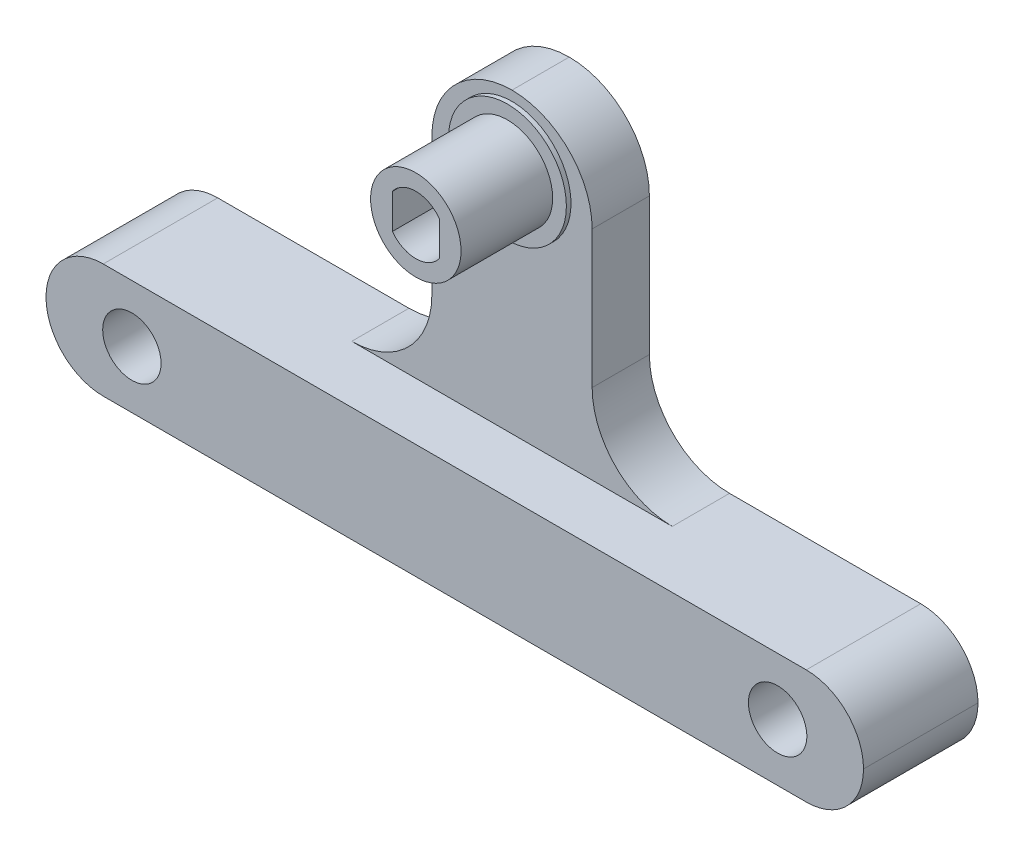
from build123d import *

# Parameters (mm, degrees)
SKETCH2_W           = 71.4
SKETCH2_H           = 93
SKETCH2_W_2         = 51.4
SKETCH2_H_2         = 73
BOSS_EXTRUDE1_DEPTH = 10
SKETCH3_W           = 14
SKETCH3_H           = 26
SKETCH3_R           = 2.75
BOSS_EXTRUDE2_DEPTH = 5
SKETCH4_R           = 3.95
SKETCH4_R_2         = 2.75
BOSS_EXTRUDE3_DEPTH = 8.4
SKETCH5_W           = 51.4
SKETCH5_H           = 10
CUT_EXTRUDE1_DEPTH  = 65.130647899
SKETCH6_R           = 5.15
SKETCH6_R_2         = 3.95
BOSS_EXTRUDE4_DEPTH = 0.4
SKETCH7_W           = 71.4
SKETCH7_H           = 25
CUT_EXTRUDE2_DEPTH  = 65.130647899
FILLET1_START       = -46.5
FILLET1_DEPTH       = 5
FILLET1_2_DEPTH     = 5
SKETCH10_W          = 71.4
SKETCH10_H          = 58
CUT_EXTRUDE3_DEPTH  = 65.130647899
SKETCH9_R           = 2.55
CUT_EXTRUDE4_DEPTH  = 53.440919138
FILLET2_R           = 5
SKETCH11_R          = 2.75
BOSS_EXTRUDE5_DEPTH = 13.4
CHAMFER1_SIZE       = 0.5


with BuildPart() as part:
    # Sketch2 → Boss-Extrude1 (new body)
    with BuildSketch(Plane(origin=(0, 0, 0), x_dir=(1, 0, 0), z_dir=(0, 1, 0))):
        Rectangle(SKETCH2_W, SKETCH2_H)
        Rectangle(SKETCH2_W_2, SKETCH2_H_2, mode=Mode.SUBTRACT)
    extrude(amount=BOSS_EXTRUDE1_DEPTH)

    # Sketch3 → Boss-Extrude2 (add)
    with BuildSketch(Plane(origin=(0, 0, -46.5), x_dir=(-1, 0, 0), z_dir=(0, 0, -1))):
        with Locations((0, 23)):
            Rectangle(SKETCH3_W, SKETCH3_H)
        with Locations((0, 30)):
            Circle(SKETCH3_R, mode=Mode.SUBTRACT)
    extrude(amount=-BOSS_EXTRUDE2_DEPTH)

    # Sketch4 → Boss-Extrude3 (add)
    with BuildSketch(Plane.XY.offset(-41.5)):
        with Locations(Location((0, 30, 0), (0, 0, 180))):
            Circle(SKETCH4_R)
        with Locations(Location((0, 30, 0), (0, 0, 180))):
            Circle(SKETCH4_R_2, mode=Mode.SUBTRACT)
    extrude(amount=BOSS_EXTRUDE3_DEPTH)

    # Sketch5 → Cut-Extrude1 (cut, through all)
    with BuildSketch(Plane(origin=(0, 10, 0), x_dir=(1, 0, 0), z_dir=(0, 1, 0))):
        with Locations((0, -41.5)):
            Rectangle(SKETCH5_W, SKETCH5_H)
    extrude(amount=-CUT_EXTRUDE1_DEPTH, mode=Mode.SUBTRACT)

    # Sketch6 → Boss-Extrude4 (add)
    with BuildSketch(Plane.XY.offset(-41.5)):
        with Locations(Location((0, 30, 0), (0, 0, 180))):
            Circle(SKETCH6_R)
        with Locations((0, 30)):
            Circle(SKETCH6_R_2, mode=Mode.SUBTRACT)
    extrude(amount=BOSS_EXTRUDE4_DEPTH)

    # Sketch7 → Cut-Extrude2 (cut, through all)
    with BuildSketch(Plane(origin=(0, 10, 0), x_dir=(1, 0, 0), z_dir=(0, 1, 0))):
        with Locations((0, -34)):
            Rectangle(SKETCH7_W, SKETCH7_H)
    extrude(amount=-CUT_EXTRUDE2_DEPTH, mode=Mode.SUBTRACT)

    # Fillet1: read off the stored shape, not the designer's step
    # Fillet1 outline → Fillet1 (cut)
    with BuildSketch(Plane.XY.offset(FILLET1_START)):
        with BuildLine():
            ThreePointArc((0, 36), (4.949747468, 33.949747468), (7, 29))
            Line((7, 29), (7, 36))
            Line((7, 36), (0, 36))
        make_face()
        with BuildLine():
            ThreePointArc((-7, 29), (-4.949747468, 33.949747468), (0, 36))
            Line((0, 36), (-7, 36))
            Line((-7, 36), (-7, 29))
        make_face()
    extrude(amount=FILLET1_DEPTH, mode=Mode.SUBTRACT)

    # Fillet1 2 outline → Fillet1 2 (add)
    with BuildSketch(Plane.XY.offset(FILLET1_START)):
        with BuildLine():
            ThreePointArc((14, 10), (9.050252532, 12.050252532), (7, 17))
            Line((7, 17), (7, 10))
            Line((7, 10), (14, 10))
        make_face()
        with BuildLine():
            Line((-14, 10), (-7, 10))
            Line((-7, 10), (-7, 17))
            ThreePointArc((-7, 17), (-9.050252532, 12.050252532), (-14, 10))
        make_face()
    extrude(amount=FILLET1_2_DEPTH)

    # Sketch10 → Cut-Extrude3 (cut, through all)
    with BuildSketch(Plane(origin=(0, 10, 0), x_dir=(1, 0, 0), z_dir=(0, 1, 0))):
        with Locations((0, 7.5)):
            Rectangle(SKETCH10_W, SKETCH10_H)
    extrude(amount=-CUT_EXTRUDE3_DEPTH, mode=Mode.SUBTRACT)

    # Sketch9 → Cut-Extrude4 (cut, through all)
    with BuildSketch(Plane(origin=(0, 0, -46.5), x_dir=(-1, 0, 0), z_dir=(0, 0, -1))):
        with Locations((-28.2, 5)):
            Circle(SKETCH9_R)
        with Locations((28.2, 5)):
            Circle(SKETCH9_R)
    extrude(amount=-CUT_EXTRUDE4_DEPTH, mode=Mode.SUBTRACT)

    # Fillet2
    fillet2_edges = [part.edges().sort_by_distance(p)[0] for p in [
        (-35.7, 10, -41.5),
        (-35.7, 0, -41.5),
        (35.7, 0, -41.5),
        (35.7, 10, -41.5),
    ]]
    fillet(fillet2_edges, radius=FILLET2_R - 0.0001)  # a hair under: the kernel refuses the full size

    # Sketch11 → Boss-Extrude5 (add)
    with BuildSketch(Plane(origin=(0, 0, -46.5), x_dir=(-1, 0, 0), z_dir=(0, 0, -1))):
        with Locations((0, 30)):
            Circle(SKETCH11_R)
        with BuildLine():
            Line((-2.05, 31.516575089), (-2.05, 28.483424911))
            ThreePointArc((-2.05, 28.483424911), (0, 27.45), (2.05, 28.483424911))
            Line((2.05, 28.483424911), (2.05, 31.516575089))
            ThreePointArc((2.05, 31.516575089), (0, 32.55), (-2.05, 31.516575089))
        make_face(mode=Mode.SUBTRACT)
    extrude(amount=-BOSS_EXTRUDE5_DEPTH)

    # Chamfer1
    chamfer1_edges = [part.edges().sort_by_distance(p)[0] for p in [
        (0, 32.55, -46.5),
        (-2.05, 30, -46.5),
        (0, 27.45, -46.5),
        (2.05, 30, -46.5),
    ]]
    chamfer(chamfer1_edges, length=CHAMFER1_SIZE)


solid = part.part
